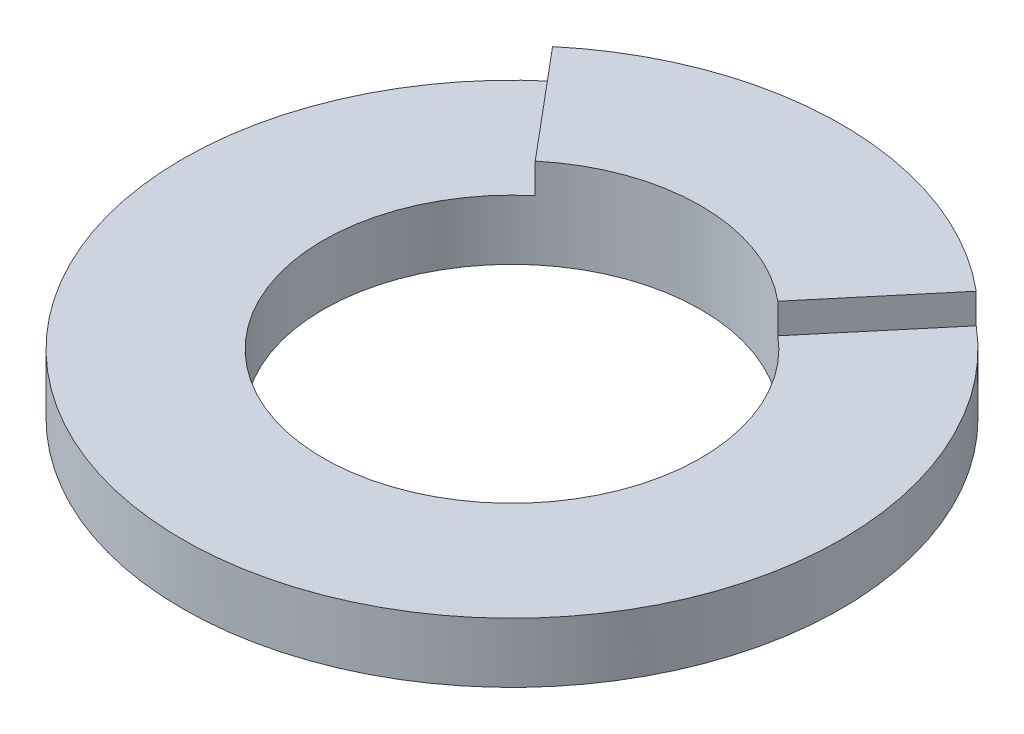
from build123d import *
from build123d.topology import SkipClean

# Parameters (mm, degrees)
SKETCH1_R           = 5.5
SKETCH1_R_2         = 3.15
BOSS_EXTRUDE1_DEPTH = 1
BOSS_EXTRUDE2_DEPTH = 0.5


with BuildPart() as part:
    # Sketch1 → Boss-Extrude1 (new body)
    with BuildSketch(Plane(origin=(0, 0, 0), x_dir=(1, 0, 0), z_dir=(0, 1, 0))):
        Circle(SKETCH1_R)
        Circle(SKETCH1_R_2, mode=Mode.SUBTRACT)
    extrude(amount=BOSS_EXTRUDE1_DEPTH)

    # Sketch2 → Boss-Extrude2 (add)
    with SkipClean():  # the faces are left unmerged after this step: merging them gives an invalid solid
        with BuildSketch(Plane(origin=(0, 1, 0), x_dir=(1, 0, 0), z_dir=(0, 1, 0))):
            with BuildLine():
                Line((3.535714286, 4.212923509), (2.025, 2.412856191))
                ThreePointArc((2.025, 2.412856191), (0, 3.15), (-2.025, 2.412856191))
                Line((-2.025, 2.412856191), (-3.535714286, 4.212923509))
                ThreePointArc((-3.535714286, 4.212923509), (0, 5.5), (3.535714286, 4.212923509))
            make_face()
        extrude(amount=BOSS_EXTRUDE2_DEPTH)


solid = part.part
